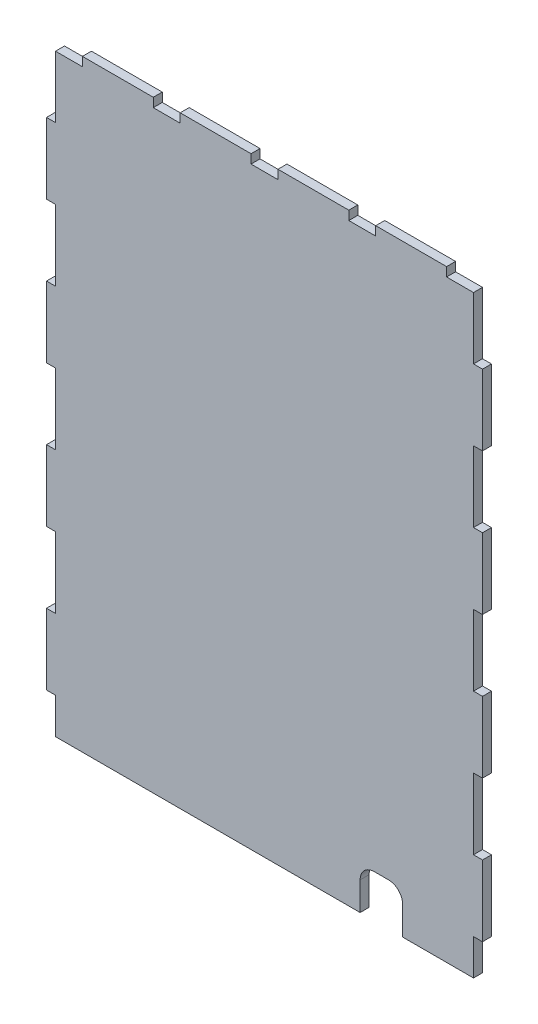
from build123d import *

# Parameters (mm, degrees)
BOSS_EXTRUDE1_DEPTH = 6.35
SKETCH3_W           = 30
SKETCH3_H           = 30
CUT_EXTRUDE1_DEPTH  = 517.127896843
FILLET1_R           = 10


with BuildPart() as part:
    # Sketch2 → Boss-Extrude1 (new body)
    with BuildSketch(Plane.XY):
        Polygon((0, 0), (19, 0), (19, 6.35), (69, 6.35), (69, 0), (88, 0), (88, 6.35), (138, 6.35), (138, 0), (157, 0), (157, 6.35), (207, 6.35), (207, 0), (226, 0), (226, 6.35), (276, 6.35), (276, 0), (295, 0), (295, -43.65), (301.35, -43.65), (301.35, -93.65), (295, -93.65), (295, -143.65), (301.35, -143.65), (301.35, -193.65), (295, -193.65), (295, -243.65), (301.35, -243.65), (301.35, -293.65), (295, -293.65), (295, -343.65), (301.35, -343.65), (301.35, -393.65), (295, -393.65), (295, -418.97), (0, -418.97), (0, -393.65), (-6.35, -393.65), (-6.35, -343.65), (0, -343.65), (0, -293.65), (-6.35, -293.65), (-6.35, -243.65), (0, -243.65), (0, -193.65), (-6.35, -193.65), (-6.35, -143.65), (0, -143.65), (0, -93.65), (-6.35, -93.65), (-6.35, -43.65), (0, -43.65), align=None)
    extrude(amount=BOSS_EXTRUDE1_DEPTH)

    # Sketch3 → Cut-Extrude1 (cut, through all)
    with BuildSketch(Plane.XY.offset(6.35)):
        with Locations((230, -403.97)):
            Rectangle(SKETCH3_W, SKETCH3_H)
    extrude(amount=-CUT_EXTRUDE1_DEPTH, mode=Mode.SUBTRACT)

    # Fillet1
    fillet1_edges = [part.edges().sort_by_distance(p)[0] for p in [
        (245, -388.97, 3.175),
        (215, -388.97, 3.175),
    ]]
    fillet(fillet1_edges, radius=FILLET1_R)


solid = part.part
